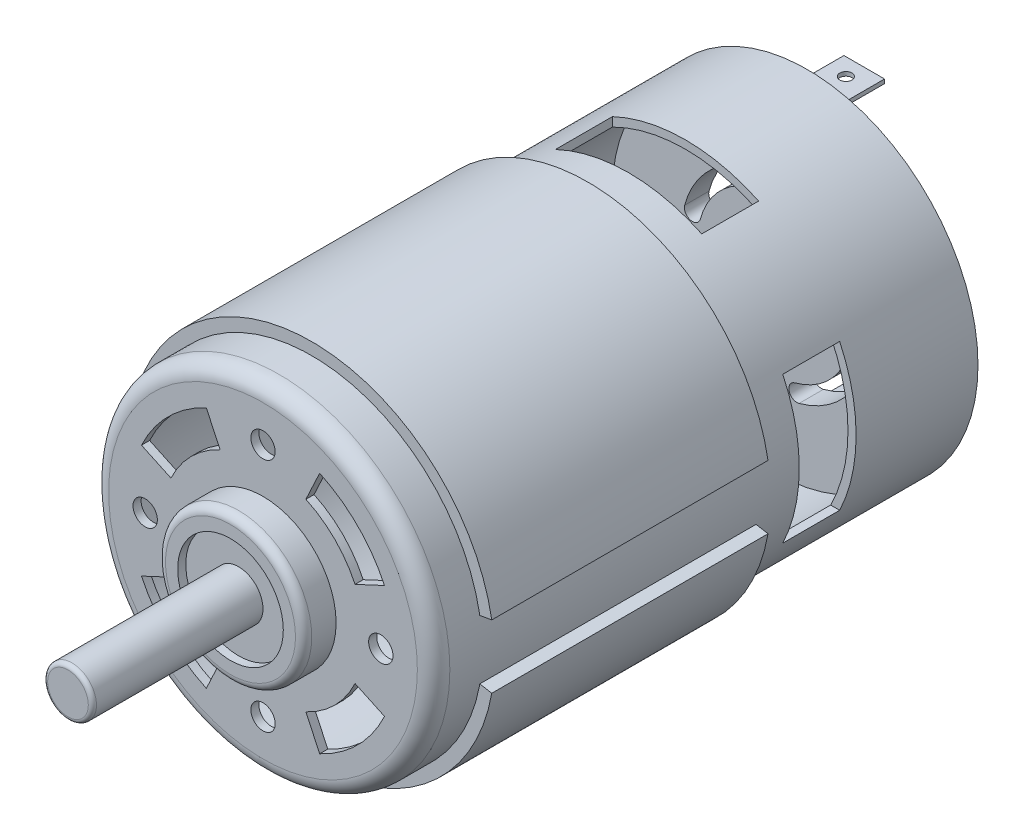
from build123d import *

# Parameters (mm, degrees)
SKETCH1_R               = 21
BOSS_EXTRUDE1_DEPTH     = 67
SHELL1_T                = -1
FILLET1_R               = 2
CUT_EXTRUDE1_REACH      = 75.287
SKETCH2_R               = 1.5
SKETCH3_R               = 9
BOSS_EXTRUDE2_DEPTH     = 4
FILLET2_R               = 1
SKETCH4_R               = 6.5
CUT_EXTRUDE2_DEPTH      = 1
SKETCH5_R               = 3
BOSS_EXTRUDE3_DEPTH     = 21
FILLET3_R               = 0.5
CUT_EXTRUDE3_REACH      = 83.817
CUT_EXTRUDE3_END_RADIUS = 20
SKETCH6_W               = 18
SKETCH6_H               = 7
CIRPATTERN1_COUNT       = 4
BOSS_EXTRUDE4_START     = -6
SKETCH7_R               = 22.5
SKETCH7_R_2             = 21
BOSS_EXTRUDE4_DEPTH     = 34
CUT_EXTRUDE4_DEPTH      = 34
BOSS_EXTRUDE5_START     = -2
SKETCH10_R              = 20
BOSS_EXTRUDE5_DEPTH     = 2
SKETCH11_R              = 15
BOSS_EXTRUDE6_DEPTH     = 1
FILLET4_R               = 1
SKETCH12_R              = 7.5
BOSS_EXTRUDE7_DEPTH     = 5
SKETCH13_R              = 4
BOSS_EXTRUDE8_DEPTH     = 2
BOSS_EXTRUDE9_START     = 5
SKETCH14_R              = 3
BOSS_EXTRUDE9_DEPTH     = 5
FILLET5_R               = 0.5
FILLET6_R               = 1
FILLET7_R               = 1
SKETCH15_R              = 1
CUT_EXTRUDE5_DEPTH      = 3
BOSS_EXTRUDE10_DEPTH    = 2
BOSS_EXTRUDE10_2_DEPTH  = 2
SKETCH17_W              = 5
SKETCH17_H              = 0.5
BOSS_EXTRUDE11_DEPTH    = 7
SKETCH18_R              = 0.75
CUT_EXTRUDE6_DEPTH      = 7
CIRPATTERN2_COUNT       = 2


with BuildPart() as part:
    # Sketch1 → Boss-Extrude1 (new body)
    with BuildSketch(Plane.XY):
        Circle(SKETCH1_R)
    extrude(amount=-BOSS_EXTRUDE1_DEPTH)

    # Shell1
    shell1_openings = [part.faces().sort_by_distance(p)[0] for p in [
        (0, 0, -67),
    ]]
    offset(amount=SHELL1_T, openings=shell1_openings, kind=Kind.INTERSECTION)

    # Fillet1
    fillet1_edges = [part.edges().sort_by_distance(p)[0] for p in [
        (-21, 0, 0),
    ]]
    fillet(fillet1_edges, radius=FILLET1_R)

    # Sketch2 → Cut-Extrude1 (cut, up to next)
    with BuildSketch(Plane.XY, mode=Mode.PRIVATE) as cut_extrude1_sk1:
        with Locations((14.5, 0)):
            Circle(SKETCH2_R)
    cut_extrude1_tool1 = extrude(cut_extrude1_sk1.sketch, amount=-CUT_EXTRUDE1_REACH, mode=Mode.PRIVATE) & part.part
    # Sketch2 → Cut-Extrude1 (cut, up to next)
    with BuildSketch(Plane.XY, mode=Mode.PRIVATE) as cut_extrude1_sk2:
        with Locations((0, -14.5)):
            Circle(SKETCH2_R)
    cut_extrude1_tool2 = extrude(cut_extrude1_sk2.sketch, amount=-CUT_EXTRUDE1_REACH, mode=Mode.PRIVATE) & part.part
    # Sketch2 → Cut-Extrude1 (cut, up to next)
    with BuildSketch(Plane.XY, mode=Mode.PRIVATE) as cut_extrude1_sk3:
        with Locations((-14.5, 0)):
            Circle(SKETCH2_R)
    cut_extrude1_tool3 = extrude(cut_extrude1_sk3.sketch, amount=-CUT_EXTRUDE1_REACH, mode=Mode.PRIVATE) & part.part
    # Sketch2 → Cut-Extrude1 (cut, up to next)
    with BuildSketch(Plane.XY, mode=Mode.PRIVATE) as cut_extrude1_sk4:
        with Locations((0, 14.5)):
            Circle(SKETCH2_R)
    cut_extrude1_tool4 = extrude(cut_extrude1_sk4.sketch, amount=-CUT_EXTRUDE1_REACH, mode=Mode.PRIVATE) & part.part
    # Sketch2 → Cut-Extrude1 (cut, up to next)
    with BuildSketch(Plane.XY, mode=Mode.PRIVATE) as cut_extrude1_sk5:
        with BuildLine():
            Line((11.328847338, 5.282728272), (14.954078486, 6.973201319))
            ThreePointArc((14.954078486, 6.973201319), (11.66726189, 11.66726189), (6.973201319, 14.954078486))
            Line((6.973201319, 14.954078486), (5.282728272, 11.328847338))
            ThreePointArc((5.282728272, 11.328847338), (8.838834765, 8.838834765), (11.328847338, 5.282728272))
        make_face()
    cut_extrude1_tool5 = extrude(cut_extrude1_sk5.sketch, amount=-CUT_EXTRUDE1_REACH, mode=Mode.PRIVATE) & part.part
    # Sketch2 → Cut-Extrude1 (cut, up to next)
    with BuildSketch(Plane.XY, mode=Mode.PRIVATE) as cut_extrude1_sk6:
        with BuildLine():
            Line((11.328847338, -5.282728272), (14.954078486, -6.973201319))
            ThreePointArc((14.954078486, -6.973201319), (11.66726189, -11.66726189), (6.973201319, -14.954078486))
            Line((6.973201319, -14.954078486), (5.282728272, -11.328847338))
            ThreePointArc((5.282728272, -11.328847338), (8.838834765, -8.838834765), (11.328847338, -5.282728272))
        make_face()
    cut_extrude1_tool6 = extrude(cut_extrude1_sk6.sketch, amount=-CUT_EXTRUDE1_REACH, mode=Mode.PRIVATE) & part.part
    # Sketch2 → Cut-Extrude1 (cut, up to next)
    with BuildSketch(Plane.XY, mode=Mode.PRIVATE) as cut_extrude1_sk7:
        with BuildLine():
            Line((-5.282728272, -11.328847338), (-6.973201319, -14.954078486))
            ThreePointArc((-6.973201319, -14.954078486), (-11.66726189, -11.66726189), (-14.954078486, -6.973201319))
            Line((-14.954078486, -6.973201319), (-11.328847338, -5.282728272))
            ThreePointArc((-11.328847338, -5.282728272), (-8.838834765, -8.838834765), (-5.282728272, -11.328847338))
        make_face()
    cut_extrude1_tool7 = extrude(cut_extrude1_sk7.sketch, amount=-CUT_EXTRUDE1_REACH, mode=Mode.PRIVATE) & part.part
    # Sketch2 → Cut-Extrude1 (cut, up to next)
    with BuildSketch(Plane.XY, mode=Mode.PRIVATE) as cut_extrude1_sk8:
        with BuildLine():
            Line((-11.328847338, 5.282728272), (-14.954078486, 6.973201319))
            ThreePointArc((-14.954078486, 6.973201319), (-11.66726189, 11.66726189), (-6.973201319, 14.954078486))
            Line((-6.973201319, 14.954078486), (-5.282728272, 11.328847338))
            ThreePointArc((-5.282728272, 11.328847338), (-8.838834765, 8.838834765), (-11.328847338, 5.282728272))
        make_face()
    cut_extrude1_tool8 = extrude(cut_extrude1_sk8.sketch, amount=-CUT_EXTRUDE1_REACH, mode=Mode.PRIVATE) & part.part
    add(cut_extrude1_tool1.solids().sort_by_distance((14.5, 0, 0))[0], mode=Mode.SUBTRACT)
    add(cut_extrude1_tool2.solids().sort_by_distance((0, -14.5, 0))[0], mode=Mode.SUBTRACT)
    add(cut_extrude1_tool3.solids().sort_by_distance((-14.5, 0, 0))[0], mode=Mode.SUBTRACT)
    add(cut_extrude1_tool4.solids().sort_by_distance((0, 14.5, 0))[0], mode=Mode.SUBTRACT)
    add(cut_extrude1_tool5.solids().sort_by_distance((10.109805, 10.109805, 0))[0], mode=Mode.SUBTRACT)
    add(cut_extrude1_tool6.solids().sort_by_distance((10.109805, -10.109805, 0))[0], mode=Mode.SUBTRACT)
    add(cut_extrude1_tool7.solids().sort_by_distance((-10.109805, -10.109805, 0))[0], mode=Mode.SUBTRACT)
    add(cut_extrude1_tool8.solids().sort_by_distance((-10.109805, 10.109805, 0))[0], mode=Mode.SUBTRACT)

    # Sketch3 → Boss-Extrude2 (add)
    with BuildSketch(Plane.XY):
        Circle(SKETCH3_R)
    extrude(amount=BOSS_EXTRUDE2_DEPTH)

    # Fillet2
    fillet2_edges = [part.edges().sort_by_distance(p)[0] for p in [
        (-9, 0, 4),
    ]]
    fillet(fillet2_edges, radius=FILLET2_R)

    # Sketch4 → Cut-Extrude2 (cut)
    with BuildSketch(Plane.XY.offset(4)):
        Circle(SKETCH4_R)
    extrude(amount=-CUT_EXTRUDE2_DEPTH, mode=Mode.SUBTRACT)

    # Sketch5 → Boss-Extrude3 (add)
    with BuildSketch(Plane.XY.offset(3)):
        with Locations(Location((0, 0, 0), (0, 0, 180))):
            Circle(SKETCH5_R)
    extrude(amount=BOSS_EXTRUDE3_DEPTH)

    # Fillet3
    fillet3_edges = [part.edges().sort_by_distance(p)[0] for p in [
        (3, 0, 24),
    ]]
    fillet(fillet3_edges, radius=FILLET3_R)

    # Cut-Extrude3: up to this cylinder (the profile starts outside it)
    cut_extrude3_end = Plane(origin=(0, 0, -48.5), z_dir=(0, 0, 1)) * Cylinder(CUT_EXTRUDE3_END_RADIUS, 208.634, mode=Mode.PRIVATE)
    # Sketch6 → Cut-Extrude3 (cut, up to the surface)
    with BuildSketch(Plane(origin=(0, 21, 0), x_dir=(1, 0, 0), z_dir=(0, 1, 0)), mode=Mode.PRIVATE) as cut_extrude3_sk1:
        with Locations((0, 48.5)):
            Rectangle(SKETCH6_W, SKETCH6_H)
    cut_extrude3_tool1 = extrude(cut_extrude3_sk1.sketch, amount=-CUT_EXTRUDE3_REACH, mode=Mode.PRIVATE) - cut_extrude3_end
    cut_extrude3 = cut_extrude3_tool1.solids().sort_by_distance((0, 21, -48.5))[0]
    add(cut_extrude3, mode=Mode.SUBTRACT)

    # CirPattern1: Cut-Extrude3 ×4 about axis
    cirpattern1_axis = Axis((0, 0, 0), (0, 0, 1))
    for i in range(1, CIRPATTERN1_COUNT):
        add(cut_extrude3.rotate(cirpattern1_axis, i * 360 / CIRPATTERN1_COUNT), mode=Mode.SUBTRACT)



with BuildPart() as body_2:
    # Sketch7 → Boss-Extrude4 (new body)
    with BuildSketch(Plane.XY.offset(BOSS_EXTRUDE4_START)):
        Circle(SKETCH7_R)
        Circle(SKETCH7_R_2, mode=Mode.SUBTRACT)
    extrude(amount=-BOSS_EXTRUDE4_DEPTH)

    # Sketch9 → Cut-Extrude4 (cut)
    with BuildSketch(Plane.XY.offset(-6)):
        with BuildLine():
            Line((20.680962813, 3.646611731), (22.158174443, 3.907083998))
            ThreePointArc((22.158174443, 3.907083998), (22.5, 0), (22.158174443, -3.907083998))
            Line((22.158174443, -3.907083998), (20.680962813, -3.646611731))
            ThreePointArc((20.680962813, -3.646611731), (21, 0), (20.680962813, 3.646611731))
        make_face()
    extrude(amount=-CUT_EXTRUDE4_DEPTH, mode=Mode.SUBTRACT)


with BuildPart() as body_3:
    # Sketch10 → Boss-Extrude5 (new body)
    with BuildSketch(Plane(origin=(0, 0, -67), x_dir=(-1, 0, 0), z_dir=(0, 0, -1)).offset(BOSS_EXTRUDE5_START)):
        with Locations(Location((0, 0, 0), (0, 0, 180))):
            Circle(SKETCH10_R)
    extrude(amount=-BOSS_EXTRUDE5_DEPTH)


with BuildPart() as part_1:
    add(part.part)

    add(body_3.part)  # Boss-Extrude6 merges body 3
    # Sketch11 → Boss-Extrude6 (add)
    with BuildSketch(Plane(origin=(0, 0, -65), x_dir=(-1, 0, 0), z_dir=(0, 0, -1))):
        Circle(SKETCH11_R)
    extrude(amount=BOSS_EXTRUDE6_DEPTH)

    # Fillet4
    fillet4_edges = [part_1.edges().sort_by_distance(p)[0] for p in [
        (15, 0, -66),
    ]]
    fillet(fillet4_edges, radius=FILLET4_R - 0.0001)  # a hair under: the kernel refuses the full size

    # Sketch12 → Boss-Extrude7 (add)
    with BuildSketch(Plane(origin=(0, 0, -66), x_dir=(-1, 0, 0), z_dir=(0, 0, -1))):
        Circle(SKETCH12_R)
    extrude(amount=BOSS_EXTRUDE7_DEPTH)

    # Sketch13 → Boss-Extrude8 (add)
    with BuildSketch(Plane(origin=(0, 0, -71), x_dir=(-1, 0, 0), z_dir=(0, 0, -1))):
        Circle(SKETCH13_R)
    extrude(amount=BOSS_EXTRUDE8_DEPTH)

    # Sketch14 → Boss-Extrude9 (add)
    with BuildSketch(Plane(origin=(0, 0, -73), x_dir=(-1, 0, 0), z_dir=(0, 0, -1)).offset(BOSS_EXTRUDE9_START)):
        Circle(SKETCH14_R)
    extrude(amount=-BOSS_EXTRUDE9_DEPTH)

    # Fillet5
    fillet5_edges = [part_1.edges().sort_by_distance(p)[0] for p in [
        (3, 0, -78),
    ]]
    fillet(fillet5_edges, radius=FILLET5_R)

    # Fillet6
    fillet6_edges = [part_1.edges().sort_by_distance(p)[0] for p in [
        (4, 0, -71),
    ]]
    fillet(fillet6_edges, radius=FILLET6_R)

    # Fillet7
    fillet7_edges = [part_1.edges().sort_by_distance(p)[0] for p in [
        (7.5, 0, -71),
    ]]
    fillet(fillet7_edges, radius=FILLET7_R)

    # Sketch15 → Cut-Extrude5 (cut)
    with BuildSketch(Plane(origin=(0, 0, -66), x_dir=(-1, 0, 0), z_dir=(0, 0, -1))):
        with Locations((10.5, 0)):
            Circle(SKETCH15_R)
        with Locations((-10.5, 0)):
            Circle(SKETCH15_R)
        with BuildLine():
            ThreePointArc((11.108147002, 2.976419019), (8.131727984, 8.131727984), (2.976419019, 11.108147002))
            ThreePointArc((2.976419019, 11.108147002), (1.751674147, 10.401040221), (2.458780928, 9.17629535))
            ThreePointArc((2.458780928, 9.17629535), (6.717514421, 6.717514421), (9.17629535, 2.458780928))
            ThreePointArc((9.17629535, 2.458780928), (10.401040221, 1.751674147), (11.108147002, 2.976419019))
        make_face()
        with BuildLine():
            ThreePointArc((2.976419019, -11.108147002), (8.131727984, -8.131727984), (11.108147002, -2.976419019))
            ThreePointArc((11.108147002, -2.976419019), (10.401040221, -1.751674147), (9.17629535, -2.458780928))
            ThreePointArc((9.17629535, -2.458780928), (6.717514421, -6.717514421), (2.458780928, -9.17629535))
            ThreePointArc((2.458780928, -9.17629535), (1.751674147, -10.401040221), (2.976419019, -11.108147002))
        make_face()
        with BuildLine():
            ThreePointArc((-11.108147002, -2.976419019), (-8.131727984, -8.131727984), (-2.976419019, -11.108147002))
            ThreePointArc((-2.976419019, -11.108147002), (-1.751674147, -10.401040221), (-2.458780928, -9.17629535))
            ThreePointArc((-2.458780928, -9.17629535), (-6.717514421, -6.717514421), (-9.17629535, -2.458780928))
            ThreePointArc((-9.17629535, -2.458780928), (-10.401040221, -1.751674147), (-11.108147002, -2.976419019))
        make_face()
        with BuildLine():
            ThreePointArc((-2.976419019, 11.108147002), (-8.131727984, 8.131727984), (-11.108147002, 2.976419019))
            ThreePointArc((-11.108147002, 2.976419019), (-10.401040221, 1.751674147), (-9.17629535, 2.458780928))
            ThreePointArc((-9.17629535, 2.458780928), (-6.717514421, 6.717514421), (-2.458780928, 9.17629535))
            ThreePointArc((-2.458780928, 9.17629535), (-1.751674147, 10.401040221), (-2.976419019, 11.108147002))
        make_face()
    extrude(amount=-CUT_EXTRUDE5_DEPTH, mode=Mode.SUBTRACT)


with BuildPart() as body_3_2:
    # Sketch16 → Boss-Extrude10 (new body)
    with BuildSketch(Plane(origin=(0, 0, -65), x_dir=(-1, 0, 0), z_dir=(0, 0, -1))):
        with BuildLine():
            Line((-4.5, 19.48717527), (-4.5, 15.48717527))
            Line((-4.5, 15.48717527), (4.5, 15.48717527))
            Line((4.5, 15.48717527), (4.5, 19.48717527))
            ThreePointArc((4.5, 19.48717527), (0, 20), (-4.5, 19.48717527))
        make_face()
    extrude(amount=BOSS_EXTRUDE10_DEPTH)


with BuildPart() as body_4:
    # Sketch16 → Boss-Extrude10 2 (new body)
    with BuildSketch(Plane(origin=(0, 0, -65), x_dir=(-1, 0, 0), z_dir=(0, 0, -1))):
        with BuildLine():
            Line((4.5, -19.48717527), (4.5, -15.48717527))
            Line((4.5, -15.48717527), (-4.5, -15.48717527))
            Line((-4.5, -15.48717527), (-4.5, -19.48717527))
            ThreePointArc((-4.5, -19.48717527), (0, -20), (4.5, -19.48717527))
        make_face()
    extrude(amount=BOSS_EXTRUDE10_2_DEPTH)


with BuildPart() as body_5:
    # Sketch17 → Boss-Extrude11 (new body)
    with BuildSketch(Plane(origin=(0, 0, -67), x_dir=(-1, 0, 0), z_dir=(0, 0, -1))):
        with Locations((0, 17.48717527)):
            Rectangle(SKETCH17_W, SKETCH17_H)
    extrude(amount=BOSS_EXTRUDE11_DEPTH)

    # Sketch18 → Cut-Extrude6 (cut)
    with BuildSketch(Plane.XZ.offset(-17.23717527)):
        with Locations(Location((-0.141118763, -71.883747027, 0), (0, 0, 270))):
            Circle(SKETCH18_R)
    extrude(amount=-CUT_EXTRUDE6_DEPTH, mode=Mode.SUBTRACT)


with BuildPart() as cirpattern2_1:
    # CirPattern2: pattern copy
    add(body_5.part.rotate(Axis((0, 0, 0), (0, 0, 1)), 1 * 360 / CIRPATTERN2_COUNT))


solid = Compound([body_2.part, part_1.part, body_3_2.part, body_4.part, body_5.part, cirpattern2_1.part])
